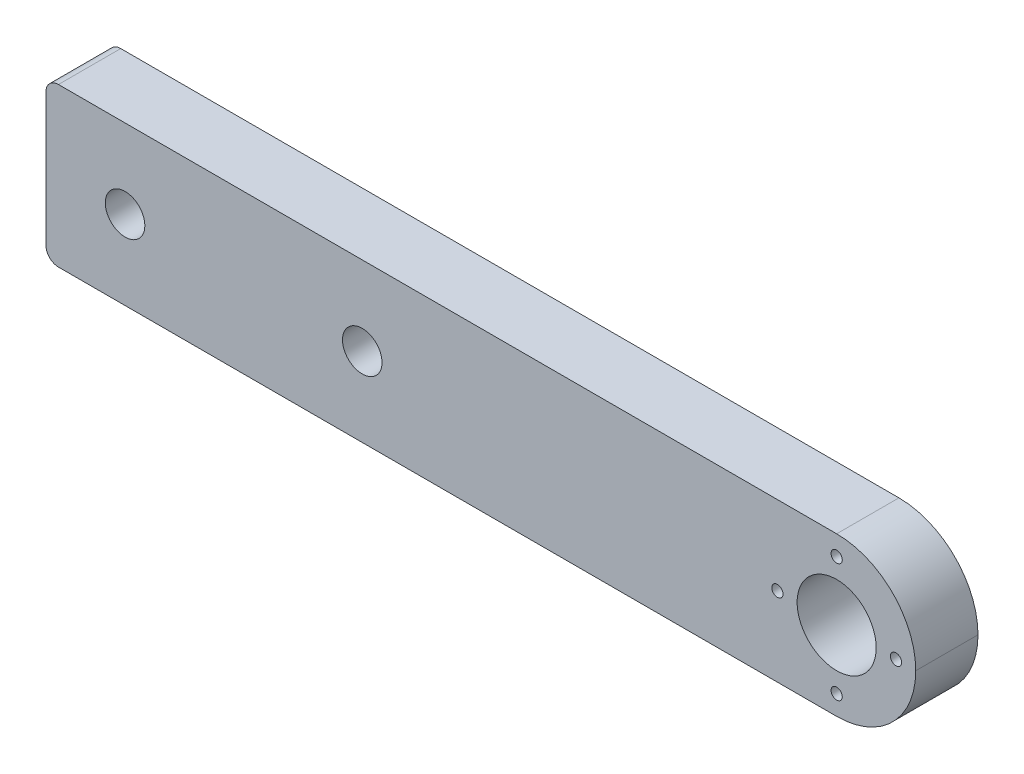
from build123d import *

# Parameters (mm, degrees)
SKETCH1_R           = 3.175
SKETCH1_R_2         = 6.35
SKETCH1_R_3         = 0.9
BOSS_EXTRUDE1_DEPTH = 10
FILLET2_R           = 2
FILLET3_R           = 12.7


with BuildPart() as part:
    # Sketch1 → Boss-Extrude1 (new body)
    with BuildSketch(Plane.XY):
        Polygon((-63.5, -12.7), (-63.5, 12.7), (63.5, 12.7), (76.2, 12.7), (76.2, -12.7), (63.5, -12.7), align=None)
        with Locations((-50.8, 0)):
            Circle(SKETCH1_R, mode=Mode.SUBTRACT)
        with Locations((63.5, 0)):
            Circle(SKETCH1_R_2, mode=Mode.SUBTRACT)
        with Locations((63.5, 9.525)):
            Circle(SKETCH1_R_3, mode=Mode.SUBTRACT)
        with Locations((63.5, -9.525)):
            Circle(SKETCH1_R_3, mode=Mode.SUBTRACT)
        with Locations((53.975, 0)):
            Circle(SKETCH1_R_3, mode=Mode.SUBTRACT)
        with Locations((73.025, 0)):
            Circle(SKETCH1_R_3, mode=Mode.SUBTRACT)
        with Locations((-12.7, 0)):
            Circle(SKETCH1_R, mode=Mode.SUBTRACT)
    extrude(amount=BOSS_EXTRUDE1_DEPTH)

    # Fillet2
    fillet2_edges = [part.edges().sort_by_distance(p)[0] for p in [
        (-63.5, -12.7, 5),
        (-63.5, 12.7, 5),
    ]]
    fillet(fillet2_edges, radius=FILLET2_R)

    # Fillet3
    fillet3_edges = [part.edges().sort_by_distance(p)[0] for p in [
        (76.2, 12.7, 5),
        (76.2, -12.7, 5),
    ]]
    fillet(fillet3_edges, radius=FILLET3_R - 0.0001)  # a hair under: the kernel refuses the full size


solid = part.part
